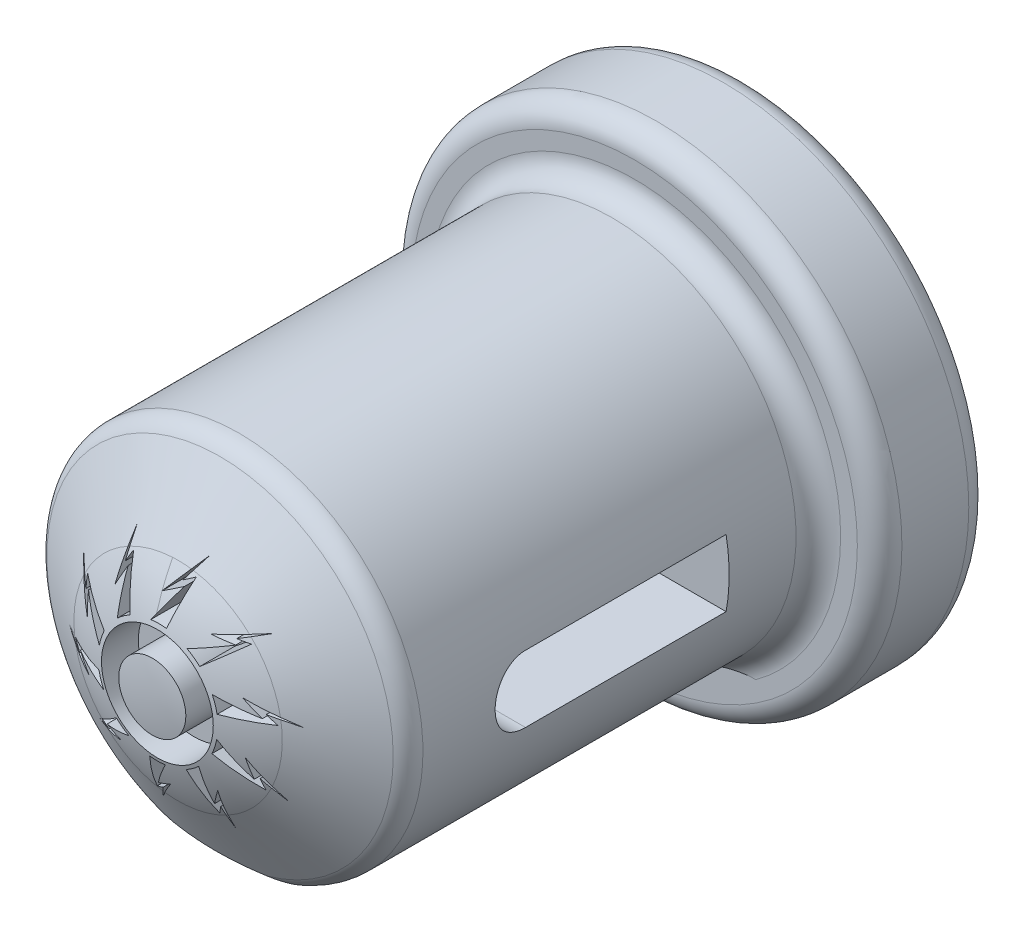
from build123d import *

# Parameters (mm, degrees)
SALIENTE_EXTRUIR1_DEPTH = 23.3
CROQUIS2_R              = 11
SALIENTE_EXTRUIR2_DEPTH = 5
CORTAR_EXTRUIR1_REACH   = 30.016
REDONDEO3_R             = 1
REDONDEO2_R             = 1
CROQUIS5_R              = 2.5
CROQUIS5_R_2            = 1.5
CORTAR_EXTRUIR2_DEPTH   = 2
CHAFL_N1_SIZE           = 0.5
CORTAR_EXTRUIR3_REACH   = 36.769


with BuildPart() as part:
    # Croquis1 → Saliente-Extruir1 (new body)
    with BuildSketch(Plane.XY):
        with BuildLine():
            Line((3.497096549, -7.472135955), (-3.497096549, -7.472135955))
            ThreePointArc((-3.497096549, -7.472135955), (0, 8.25), (3.497096549, -7.472135955))
        make_face()
        with BuildLine():
            Line((2.75, -4.472135955), (-2.75, -4.472135955))
            ThreePointArc((-2.75, -4.472135955), (0, 5.25), (2.75, -4.472135955))
        make_face(mode=Mode.SUBTRACT)
    extrude(amount=SALIENTE_EXTRUIR1_DEPTH)

    # Croquis2 → Saliente-Extruir2 (add)
    with BuildSketch(Plane(origin=(0, 0, 0), x_dir=(-1, 0, 0), z_dir=(0, 0, -1))):
        Circle(CROQUIS2_R)
        with BuildLine():
            Line((2.75, -4.472135955), (-2.75, -4.472135955))
            ThreePointArc((-2.75, -4.472135955), (0, 5.25), (2.75, -4.472135955))
        make_face(mode=Mode.SUBTRACT)
    extrude(amount=-SALIENTE_EXTRUIR2_DEPTH)

    # Croquis3 → Revolución1 (revolve)
    with BuildSketch(Plane(origin=(0, 0, 0), x_dir=(0, 0, -1), z_dir=(1, 0, 0))):
        with BuildLine():
            Line((-23.3, 0), (-23.3, 8.25))
            Line((-23.3, 8.25), (-25.473225484, 4.675672007))
            ThreePointArc((-25.473225484, 4.675672007), (-26.449443722, 2.427842124), (-26.783096013, 0))
            Line((-26.783096013, 0), (-23.3, 0))
        make_face()
    revolve(axis=Axis((0, 0, 26.783096013), (0, 0, -1)))

    # Croquis4 → Cortar-Extruir1 (cut, up to next)
    with BuildSketch(Plane(origin=(0, 0, 23.3), x_dir=(-1, 0, 0), z_dir=(0, 0, -1)), mode=Mode.PRIVATE) as cortar_extruir1_sk1:
        with BuildLine():
            Line((3.497096549, -7.472135955), (-3.497096549, -7.472135955))
            ThreePointArc((-3.497096549, -7.472135955), (0, -8.25), (3.497096549, -7.472135955))
        make_face()
    cortar_extruir1_tool1 = extrude(cortar_extruir1_sk1.sketch, amount=-CORTAR_EXTRUIR1_REACH, mode=Mode.PRIVATE) & part.part
    add(cortar_extruir1_tool1.solids().sort_by_distance((0, -7.784574, 23.3))[0], mode=Mode.SUBTRACT)

    # Redondeo3
    redondeo3_edges = [part.edges().sort_by_distance(p)[0] for p in [
        (11, 0, 0),
        (11, 0, 5),
        (0, 8.25, 5),
        (8.053186376, 1.791281437, 23.3),
    ]]
    fillet(redondeo3_edges, radius=REDONDEO3_R)

    # Redondeo2
    redondeo2_edges = [part.edges().sort_by_distance(p)[0] for p in [
        (0, -4.472135955, 0),
        (0, 5.25, 0),
    ]]
    fillet(redondeo2_edges, radius=REDONDEO2_R)

    # Croquis5 → Cortar-Extruir2 (cut)
    # profile 1 of 11: a face of its own
    with BuildSketch(Plane.XY.offset(26.783096013)):
        with Locations((0.025979011, -0.015198441)):
            Circle(CROQUIS5_R)
        with Locations((0.025979011, -0.015198441)):
            Circle(CROQUIS5_R_2, mode=Mode.SUBTRACT)
    # profile 2 of 11: a face of its own
    with BuildSketch(Plane.XY.offset(26.783096013)):
        with BuildLine():
            Line((1.302557766, 2.344074393), (2.881616708, 2.973814702))
            Line((2.881616708, 2.973814702), (1.998734761, 3.074340177))
            Line((1.998734761, 3.074340177), (3.892874702, 3.589350961))
            Line((3.892874702, 3.589350961), (2.860263918, 3.177538192))
            Line((2.860263918, 3.177538192), (3.350806324, 3.121684736))
            Line((3.350806324, 3.121684736), (1.868869662, 1.932624716))
            ThreePointArc((1.868869662, 1.932624716), (1.599104223, 2.156780008), (1.302557766, 2.344074393))
        make_face()
    # profile 3 of 11: a face of its own
    with BuildSketch(Plane.XY.offset(26.783096013)):
        with BuildLine():
            Line((-0.324020989, 2.662020265), (0.583312464, 4.099638436))
            Line((0.583312464, 4.099638436), (-0.190041428, 3.662020265))
            Line((-0.190041428, 3.662020265), (1.039634231, 5.192020265))
            Line((1.039634231, 5.192020265), (0.44629203, 4.251903346))
            Line((0.44629203, 4.251903346), (0.875979011, 4.495050543))
            Line((0.875979011, 4.495050543), (0.375979011, 2.662020265))
            ThreePointArc((0.375979011, 2.662020265), (0.025979011, 2.684801559), (-0.324020989, 2.662020265))
        make_face()
    # profile 4 of 11: a face of its own
    with BuildSketch(Plane.XY.offset(26.783096013)):
        with BuildLine():
            Line((2.431603727, 1.130771774), (4.079241313, 0.712094828))
            Line((4.079241313, 0.712094828), (3.424062205, 1.312366634))
            Line((3.424062205, 1.312366634), (5.259169351, 0.615671587))
            Line((5.259169351, 0.615671587), (4.181712206, 0.889461449))
            Line((4.181712206, 0.889461449), (4.545739511, 0.555941462))
            Line((4.545739511, 0.555941462), (2.647915623, 0.465032213))
            ThreePointArc((2.647915623, 0.465032213), (2.561425973, 0.804941801), (2.431603727, 1.130771774))
        make_face()
    # profile 5 of 11: a face of its own
    with BuildSketch(Plane.XY.offset(26.783096013)):
        with BuildLine():
            Line((2.631859712, -0.514447228), (3.718734384, -1.821621067))
            Line((3.718734384, -1.821621067), (3.541514267, -0.950886357))
            Line((3.541514267, -0.950886357), (4.61664006, -2.593173407))
            Line((4.61664006, -2.593173407), (3.905888563, -1.738359335))
            Line((3.905888563, -1.738359335), (4.004354709, -2.222152555))
            Line((4.004354709, -2.222152555), (2.415547816, -1.180186789))
            ThreePointArc((2.415547816, -1.180186789), (2.545370062, -0.854356816), (2.631859712, -0.514447228))
        make_face()
    # profile 6 of 11: a face of its own
    with BuildSketch(Plane.XY.offset(26.783096013)):
        with BuildLine():
            Line((1.82683474, -1.963164875), (1.937797316, -3.659539629))
            Line((1.937797316, -3.659539629), (2.30622825, -2.85093308))
            Line((2.30622825, -2.85093308), (2.210711181, -4.811514298))
            Line((2.210711181, -4.811514298), (2.138148245, -3.702185939))
            Line((2.138148245, -3.702185939), (1.933442511, -4.151459824))
            Line((1.933442511, -4.151459824), (1.260522844, -2.374614551))
            ThreePointArc((1.260522844, -2.374614551), (1.5570693, -2.187320167), (1.82683474, -1.963164875))
        make_face()
    # profile 7 of 11: a face of its own
    with BuildSketch(Plane.XY.offset(26.783096013)):
        with BuildLine():
            Line((0.324020989, -2.662020265), (-0.583312464, -4.099638436))
            Line((-0.583312464, -4.099638436), (0.190041428, -3.662020265))
            Line((0.190041428, -3.662020265), (-1.039634231, -5.192020265))
            Line((-1.039634231, -5.192020265), (-0.44629203, -4.251903346))
            Line((-0.44629203, -4.251903346), (-0.875979011, -4.495050543))
            Line((-0.875979011, -4.495050543), (-0.375979011, -2.662020265))
            ThreePointArc((-0.375979011, -2.662020265), (-0.025979011, -2.684801559), (0.324020989, -2.662020265))
        make_face()
    # profile 8 of 11: a face of its own
    with BuildSketch(Plane.XY.offset(26.783096013)):
        with BuildLine():
            Line((-1.302557766, -2.344074393), (-2.881616708, -2.973814702))
            Line((-2.881616708, -2.973814702), (-1.998734761, -3.074340177))
            Line((-1.998734761, -3.074340177), (-3.892874702, -3.589350961))
            Line((-3.892874702, -3.589350961), (-2.860263918, -3.177538192))
            Line((-2.860263918, -3.177538192), (-3.350806324, -3.121684736))
            Line((-3.350806324, -3.121684736), (-1.868869662, -1.932624716))
            ThreePointArc((-1.868869662, -1.932624716), (-1.599104223, -2.156780008), (-1.302557766, -2.344074393))
        make_face()
    # profile 9 of 11: a face of its own
    with BuildSketch(Plane.XY.offset(26.783096013)):
        with BuildLine():
            Line((-2.431603727, -1.130771774), (-4.079241313, -0.712094828))
            Line((-4.079241313, -0.712094828), (-3.424062205, -1.312366634))
            Line((-3.424062205, -1.312366634), (-5.259169351, -0.615671587))
            Line((-5.259169351, -0.615671587), (-4.181712206, -0.889461449))
            Line((-4.181712206, -0.889461449), (-4.545739511, -0.555941462))
            Line((-4.545739511, -0.555941462), (-2.647915623, -0.465032213))
            ThreePointArc((-2.647915623, -0.465032213), (-2.561425973, -0.804941801), (-2.431603727, -1.130771774))
        make_face()
    # profile 10 of 11: a face of its own
    with BuildSketch(Plane.XY.offset(26.783096013)):
        with BuildLine():
            Line((-2.631859712, 0.514447228), (-3.718734384, 1.821621067))
            Line((-3.718734384, 1.821621067), (-3.541514267, 0.950886357))
            Line((-3.541514267, 0.950886357), (-4.61664006, 2.593173407))
            Line((-4.61664006, 2.593173407), (-3.905888563, 1.738359335))
            Line((-3.905888563, 1.738359335), (-4.004354709, 2.222152555))
            Line((-4.004354709, 2.222152555), (-2.415547816, 1.180186789))
            ThreePointArc((-2.415547816, 1.180186789), (-2.545370062, 0.854356816), (-2.631859712, 0.514447228))
        make_face()
    # profile 11 of 11: a face of its own
    with BuildSketch(Plane.XY.offset(26.783096013)):
        with BuildLine():
            Line((-1.82683474, 1.963164875), (-1.937797316, 3.659539629))
            Line((-1.937797316, 3.659539629), (-2.30622825, 2.85093308))
            Line((-2.30622825, 2.85093308), (-2.210711181, 4.811514298))
            Line((-2.210711181, 4.811514298), (-2.138148245, 3.702185939))
            Line((-2.138148245, 3.702185939), (-1.933442511, 4.151459824))
            Line((-1.933442511, 4.151459824), (-1.260522844, 2.374614551))
            ThreePointArc((-1.260522844, 2.374614551), (-1.5570693, 2.187320167), (-1.82683474, 1.963164875))
        make_face()
    extrude(amount=-CORTAR_EXTRUIR2_DEPTH, mode=Mode.SUBTRACT)

    # Chaflán1
    chafl_n1_edges = [part.edges().sort_by_distance(p)[0] for p in [
        (0, 5.25, 23.3),
    ]]
    chamfer(chafl_n1_edges, length=CHAFL_N1_SIZE)

    # Croquis6 → Cortar-Extruir3 (cut, up to next)
    with BuildSketch(Plane(origin=(8.25, 0, 0), x_dir=(0, 0, -1), z_dir=(1, 0, 0)), mode=Mode.PRIVATE) as cortar_extruir3_sk1:
        with BuildLine():
            Line((-9, -1.5), (-9, 1.5))
            Line((-9, 1.5), (-18, 1.5))
            ThreePointArc((-18, 1.5), (-19.5, 0), (-18, -1.5))
            Line((-18, -1.5), (-9, -1.5))
        make_face()
    cortar_extruir3_tool1 = extrude(cortar_extruir3_sk1.sketch, amount=-CORTAR_EXTRUIR3_REACH, mode=Mode.PRIVATE) & part.part
    add(cortar_extruir3_tool1.solids().sort_by_distance((8.25, 0, 14.094555))[0], mode=Mode.SUBTRACT)


solid = part.part
